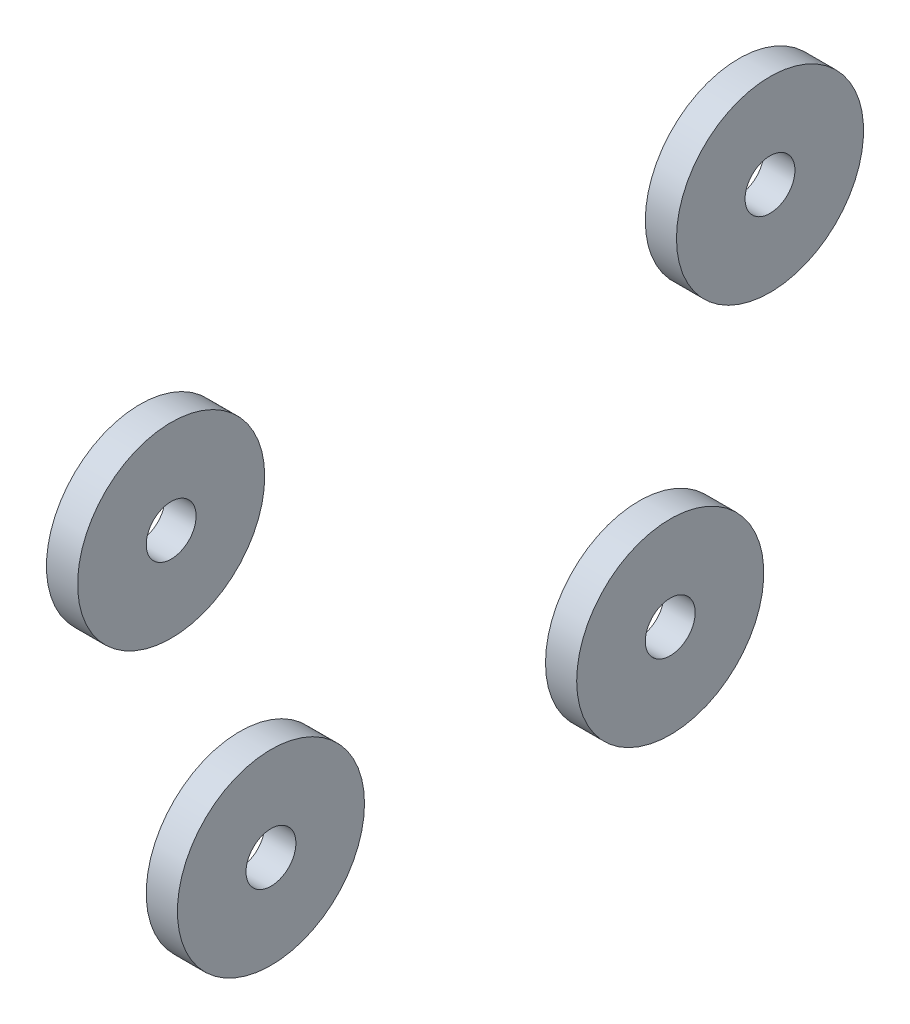
from build123d import *

# Parameters (mm, degrees)
SKETCH3_R             = 19.05
SKETCH3_R_2           = 5.08
BOSS_EXTRUDE1_DEPTH   = 6.35
BOSS_EXTRUDE1_2_DEPTH = 6.35
BOSS_EXTRUDE1_3_DEPTH = 6.35
BOSS_EXTRUDE1_4_DEPTH = 6.35


with BuildPart() as part:
    # Sketch3 → Boss-Extrude1 (new body)
    with BuildSketch(Plane(origin=(152.4, 0, 0), x_dir=(0, 0, -1), z_dir=(1, 0, 0))):
        with Locations((-60.972154839, 22.617389771)):
            Circle(SKETCH3_R)
        with Locations((-60.972154839, 22.617389771)):
            Circle(SKETCH3_R_2, mode=Mode.SUBTRACT)
    extrude(amount=-BOSS_EXTRUDE1_DEPTH)


with BuildPart() as body_2:
    # Sketch3 → Boss-Extrude1 2 (new body)
    with BuildSketch(Plane(origin=(152.4, 0, 0), x_dir=(0, 0, -1), z_dir=(1, 0, 0))):
        with Locations((-40.652154839, -45.23296028)):
            Circle(SKETCH3_R)
        with Locations((-40.652154839, -45.23296028)):
            Circle(SKETCH3_R_2, mode=Mode.SUBTRACT)
    extrude(amount=-BOSS_EXTRUDE1_2_DEPTH)


with BuildPart() as body_3:
    # Sketch3 → Boss-Extrude1 3 (new body)
    with BuildSketch(Plane(origin=(152.4, 0, 0), x_dir=(0, 0, -1), z_dir=(1, 0, 0))):
        with Locations((40.652154839, -45.23296028)):
            Circle(SKETCH3_R)
        with Locations((40.652154839, -45.23296028)):
            Circle(SKETCH3_R_2, mode=Mode.SUBTRACT)
    extrude(amount=-BOSS_EXTRUDE1_3_DEPTH)


with BuildPart() as body_4:
    # Sketch3 → Boss-Extrude1 4 (new body)
    with BuildSketch(Plane(origin=(152.4, 0, 0), x_dir=(0, 0, -1), z_dir=(1, 0, 0))):
        with Locations((60.972154839, 22.617389771)):
            Circle(SKETCH3_R)
        with Locations((60.972154839, 22.617389771)):
            Circle(SKETCH3_R_2, mode=Mode.SUBTRACT)
    extrude(amount=-BOSS_EXTRUDE1_4_DEPTH)


solid = Compound([part.part, body_2.part, body_3.part, body_4.part])
